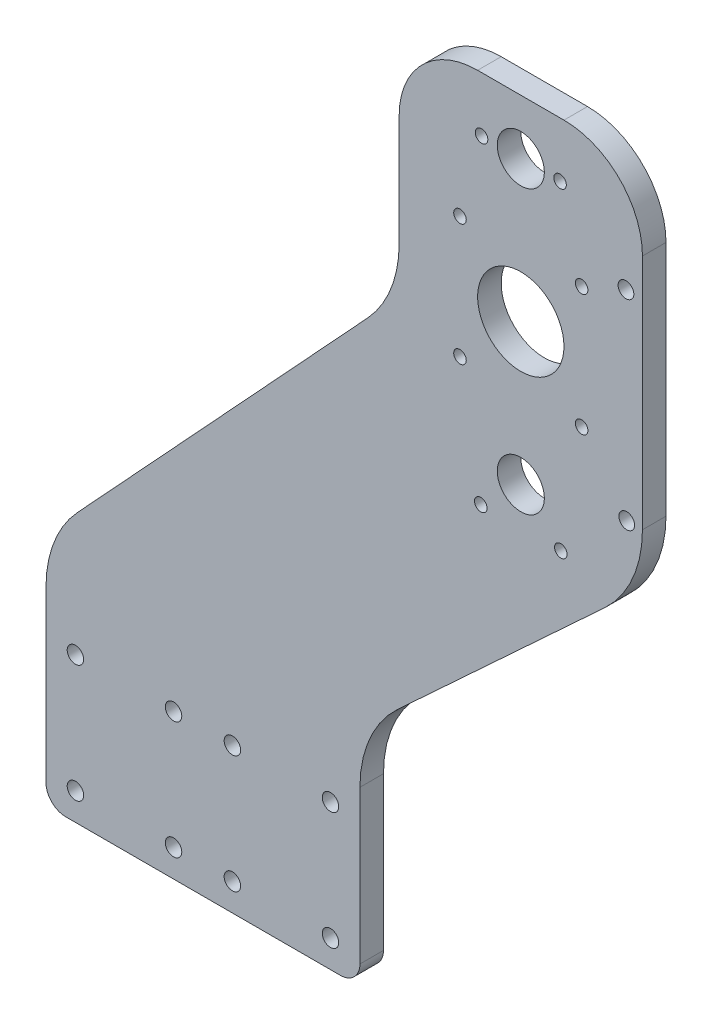
from build123d import *

# Parameters (mm, degrees)
SKETCH1_R           = 2.1
SKETCH1_R_2         = 6
SKETCH1_R_3         = 11
SKETCH1_R_4         = 1.6
SKETCH1_R_5         = 2
BOSS_EXTRUDE1_DEPTH = 6


with BuildPart() as part:
    # Sketch1 → Boss-Extrude1 (new body)
    with BuildSketch(Plane.XY):
        with BuildLine():
            Line((-58.450315728, -99.207311363), (11.549684272, -99.207311363))
            ThreePointArc((11.549684272, -99.207311363), (15.085218178, -97.742845269), (16.549684272, -94.207311363))
            Line((16.549684272, -94.207311363), (16.549684272, -55.206132823))
            ThreePointArc((16.549684272, -55.206132823), (19.062073387, -43.188177597), (26.178434127, -33.18314103))
            Line((26.178434127, -33.18314103), (78.920934418, 15.603630397))
            ThreePointArc((78.920934418, 15.603630397), (86.037295158, 25.608666964), (88.549684272, 37.62662219))
            Line((88.549684272, 37.62662219), (88.549684272, 98.042585462))
            ThreePointArc((88.549684272, 98.042585462), (82.691819896, 112.184721085), (68.549684272, 118.042585462))
            Line((68.549684272, 118.042585462), (46.549684272, 118.042585462))
            ThreePointArc((46.549684272, 118.042585462), (32.407548649, 112.184721085), (26.549684272, 98.042585462))
            Line((26.549684272, 98.042585462), (26.549684272, 69.794245525))
            ThreePointArc((26.549684272, 69.794245525), (24.483006881, 58.852148467), (18.567718404, 49.417637049))
            Line((18.567718404, 49.417637049), (-55.46834986, -30.582362951))
            ThreePointArc((-55.46834986, -30.582362951), (-61.383638337, -40.016874369), (-63.450315728, -50.958971426))
            Line((-63.450315728, -50.958971426), (-63.450315728, -94.207311363))
            ThreePointArc((-63.450315728, -94.207311363), (-61.985849634, -97.742845269), (-58.450315728, -99.207311363))
        make_face()
        with Locations((-55.950315728, -62.207311363)):
            Circle(SKETCH1_R, mode=Mode.SUBTRACT)
        with Locations((-30.950315728, -62.207311363)):
            Circle(SKETCH1_R, mode=Mode.SUBTRACT)
        with Locations((-30.950315728, -92.207311363)):
            Circle(SKETCH1_R, mode=Mode.SUBTRACT)
        with Locations((-55.950315728, -92.207311363)):
            Circle(SKETCH1_R, mode=Mode.SUBTRACT)
        with Locations((9.049684272, -92.207311363)):
            Circle(SKETCH1_R, mode=Mode.SUBTRACT)
        with Locations((-15.950315728, -92.207311363)):
            Circle(SKETCH1_R, mode=Mode.SUBTRACT)
        with Locations((-15.950315728, -62.207311363)):
            Circle(SKETCH1_R, mode=Mode.SUBTRACT)
        with Locations((9.049684272, -62.207311363)):
            Circle(SKETCH1_R, mode=Mode.SUBTRACT)
        with Locations((57.549684272, 104.042585462)):
            Circle(SKETCH1_R_2, mode=Mode.SUBTRACT)
        with Locations((57.549684272, 32.102585462)):
            Circle(SKETCH1_R_2, mode=Mode.SUBTRACT)
        with Locations((57.549684272, 68.072585462)):
            Circle(SKETCH1_R_3, mode=Mode.SUBTRACT)
        with Locations((42.049684272, 83.572585462)):
            Circle(SKETCH1_R_4, mode=Mode.SUBTRACT)
        with Locations((73.049684272, 83.572585462)):
            Circle(SKETCH1_R_4, mode=Mode.SUBTRACT)
        with Locations((73.049684272, 52.572585462)):
            Circle(SKETCH1_R_4, mode=Mode.SUBTRACT)
        with Locations((42.049684272, 52.572585462)):
            Circle(SKETCH1_R_4, mode=Mode.SUBTRACT)
        with Locations((84.549684272, 37.62662219)):
            Circle(SKETCH1_R_5, mode=Mode.SUBTRACT)
        with Locations((84.351781192, 88.518513838)):
            Circle(SKETCH1_R_5, mode=Mode.SUBTRACT)
        with Locations((47.549684272, 104.042585462)):
            Circle(SKETCH1_R_4, mode=Mode.SUBTRACT)
        with Locations((47.351781192, 22.578513838)):
            Circle(SKETCH1_R_4, mode=Mode.SUBTRACT)
        with Locations((67.549684272, 104.042585462)):
            Circle(SKETCH1_R_4, mode=Mode.SUBTRACT)
        with Locations((67.747587353, 22.578513838)):
            Circle(SKETCH1_R_4, mode=Mode.SUBTRACT)
    extrude(amount=BOSS_EXTRUDE1_DEPTH)


solid = part.part
